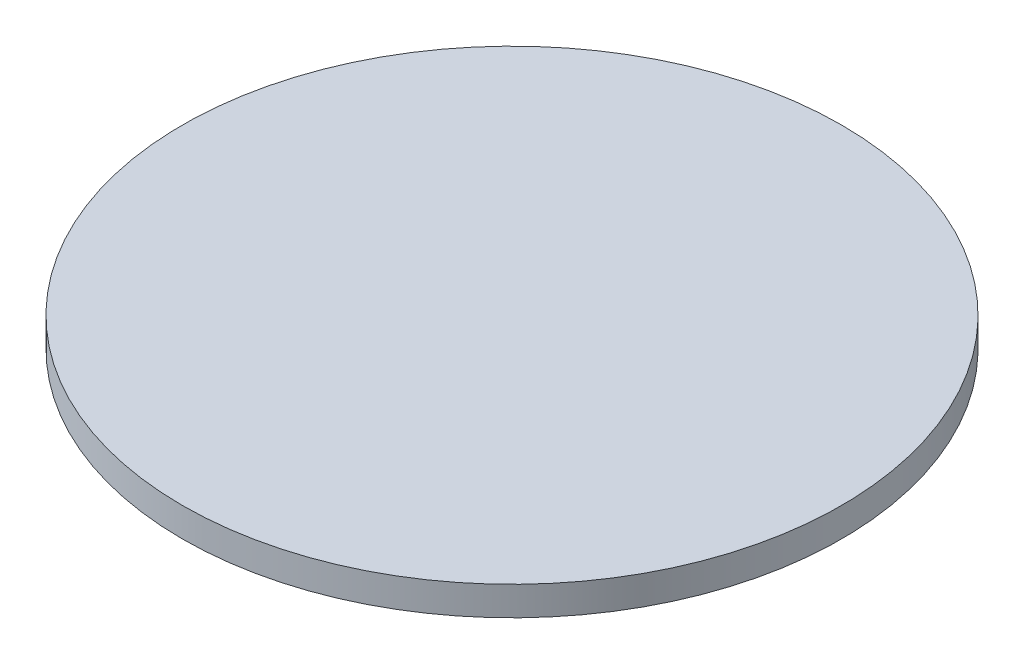
from build123d import *

# Parameters (mm, degrees)
SKETCH1_R           = 11.35
BOSS_EXTRUDE1_DEPTH = 1


with BuildPart() as part:
    # Sketch1 → Boss-Extrude1 (new body)
    with BuildSketch(Plane(origin=(0, 0, 0), x_dir=(1, 0, 0), z_dir=(0, 1, 0))):
        Circle(SKETCH1_R)
    extrude(amount=BOSS_EXTRUDE1_DEPTH)


solid = part.part
